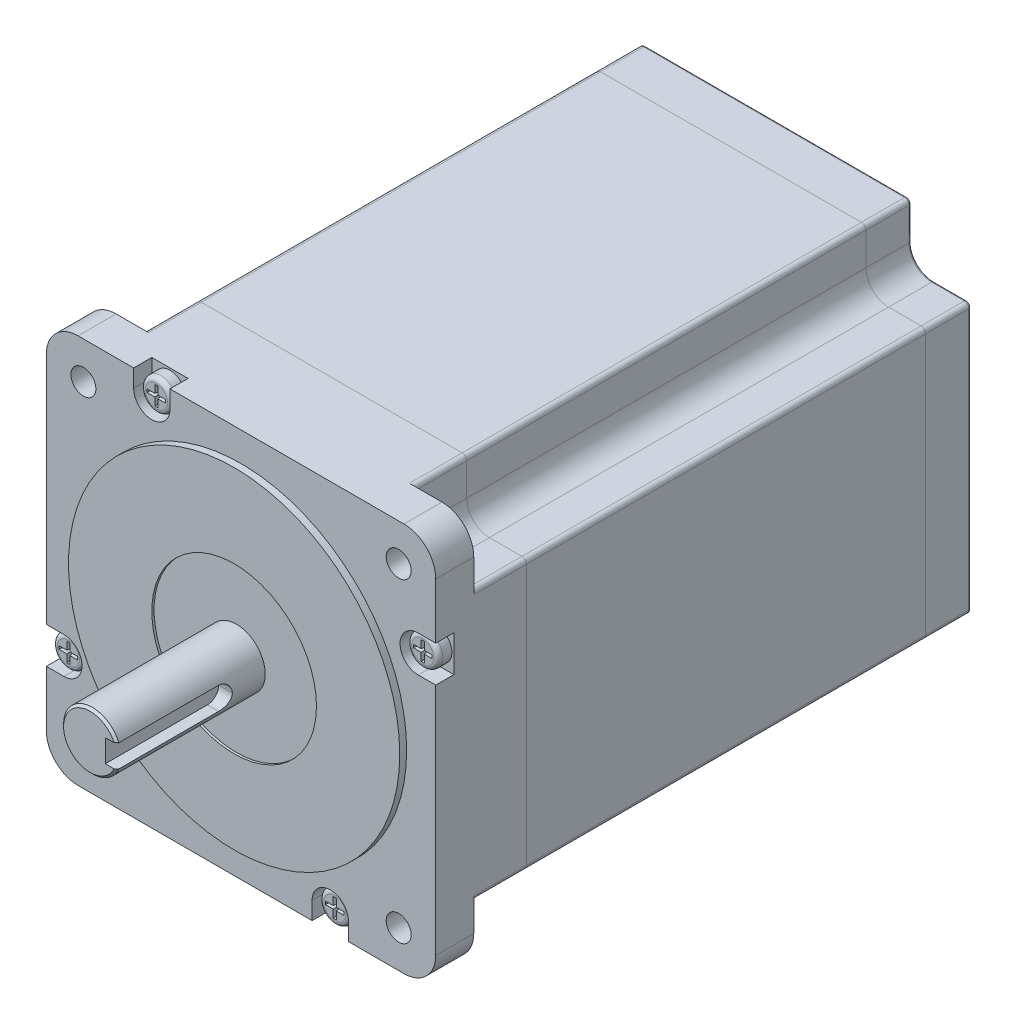
from build123d import *
from OCP.BRepFilletAPI import BRepFilletAPI_MakeChamfer

# Parameters (mm, degrees)
SKETCH1_R                = 2.75
BOSS_EXTRUDE1_DEPTH      = 118
SKETCH2_R                = 36.51
BOSS_EXTRUDE2_DEPTH      = 1.52
BOSS_EXTRUDE3_DEPTH      = 31.75
BOSS_EXTRUDE3_DEPTH_BACK = 1
SKETCH3_R                = 6.35
SKETCH4_W                = 5
SKETCH4_H                = 5
CUT_EXTRUDE1_DEPTH       = 25
FILLET1_R                = 2.5
CHAMFER1_SIZE            = 0.5
SKETCH5_R                = 18.150459798
CUT_EXTRUDE2_DEPTH       = 0.5
CUT_EXTRUDE3_DEPTH       = 109.62
FILLET2_R                = 0.5
FILLET3_R                = 1
SKETCH8_R                = 10
CUT_EXTRUDE4_DEPTH       = 1
SKETCH9_R                = 6
BOSS_EXTRUDE4_DEPTH      = 0.8
CUT_EXTRUDE5_DEPTH       = 4
SKETCH11_R               = 3.434192677
BOSS_EXTRUDE5_DEPTH      = 3
FILLET4_R                = 1
CUT_EXTRUDE6_DEPTH       = 2
CUT_EXTRUDE6_DRAFT       = -6
CHAMFER2_SIZE            = 1.5
CHAMFER2_SIZE2           = 1.685405696
CIRPATTERN3_COUNT        = 4


# Some blends are built 0.0001 mm under size
with BuildPart() as part:
    # Sketch1 → Boss-Extrude1 (new body)
    with BuildSketch(Plane.XY):
        with BuildLine():
            Line((-35.925, -42.925), (35.925, -42.925))
            ThreePointArc((35.925, -42.925), (40.874747468, -40.874747468), (42.925, -35.925))
            Line((42.925, -35.925), (42.925, 35.925))
            ThreePointArc((42.925, 35.925), (40.874747468, 40.874747468), (35.925, 42.925))
            Line((35.925, 42.925), (-35.925, 42.925))
            ThreePointArc((-35.925, 42.925), (-40.874747468, 40.874747468), (-42.925, 35.925))
            Line((-42.925, 35.925), (-42.925, -35.925))
            ThreePointArc((-42.925, -35.925), (-40.874747468, -40.874747468), (-35.925, -42.925))
        make_face()
        with Locations((-34.75, 34.75)):
            Circle(SKETCH1_R, mode=Mode.SUBTRACT)
        with Locations((34.75, 34.75)):
            Circle(SKETCH1_R, mode=Mode.SUBTRACT)
        with Locations((-34.75, -34.75)):
            Circle(SKETCH1_R, mode=Mode.SUBTRACT)
        with Locations((34.75, -34.75)):
            Circle(SKETCH1_R, mode=Mode.SUBTRACT)
    extrude(amount=BOSS_EXTRUDE1_DEPTH)

    # Sketch2 → Boss-Extrude2 (add)
    with BuildSketch(Plane.XY.offset(118)):
        Circle(SKETCH2_R)
    extrude(amount=BOSS_EXTRUDE2_DEPTH)

    # Sketch5 → Cut-Extrude2 (cut)
    with BuildSketch(Plane.XY.offset(119.52)):
        Circle(SKETCH5_R)
    extrude(amount=-CUT_EXTRUDE2_DEPTH, mode=Mode.SUBTRACT)

    # Sketch6 → Cut-Extrude3 (cut)
    with BuildSketch(Plane(origin=(0, 0, 0), x_dir=(-1, 0, 0), z_dir=(0, 0, -1))):
        with BuildLine():
            Line((-29.75, 34.75), (-29.75, 42.925))
            Line((-29.75, 42.925), (-35.925, 42.925))
            ThreePointArc((-35.925, 42.925), (-40.874747468, 40.874747468), (-42.925, 35.925))
            Line((-42.925, 35.925), (-42.925, 29.75))
            Line((-42.925, 29.75), (-34.75, 29.75))
            ThreePointArc((-34.75, 29.75), (-31.214466094, 31.214466094), (-29.75, 34.75))
        make_face()
        with BuildLine():
            Line((35.925, 42.925), (29.75, 42.925))
            Line((29.75, 42.925), (29.75, 34.75))
            ThreePointArc((29.75, 34.75), (31.214466094, 31.214466094), (34.75, 29.75))
            Line((34.75, 29.75), (42.925, 29.75))
            Line((42.925, 29.75), (42.925, 35.925))
            ThreePointArc((42.925, 35.925), (40.874747468, 40.874747468), (35.925, 42.925))
        make_face()
        with BuildLine():
            Line((29.75, -34.75), (29.75, -42.925))
            Line((29.75, -42.925), (35.925, -42.925))
            ThreePointArc((35.925, -42.925), (40.874747468, -40.874747468), (42.925, -35.925))
            Line((42.925, -35.925), (42.925, -29.75))
            Line((42.925, -29.75), (34.75, -29.75))
            ThreePointArc((34.75, -29.75), (31.214466094, -31.214466094), (29.75, -34.75))
        make_face()
        with BuildLine():
            Line((-35.925, -42.925), (-29.75, -42.925))
            Line((-29.75, -42.925), (-29.75, -34.75))
            ThreePointArc((-29.75, -34.75), (-31.214466094, -31.214466094), (-34.75, -29.75))
            Line((-34.75, -29.75), (-42.925, -29.75))
            Line((-42.925, -29.75), (-42.925, -35.925))
            ThreePointArc((-42.925, -35.925), (-40.874747468, -40.874747468), (-35.925, -42.925))
        make_face()
    extrude(amount=-CUT_EXTRUDE3_DEPTH, mode=Mode.SUBTRACT)

    # Fillet2
    fillet2_edges = [part.edges().sort_by_distance(p)[0] for p in [
        (42.925, 0, 0),
        (29.75, -38.8375, 0),
        (31.214466094, -31.214466094, 0),
        (38.8375, -29.75, 0),
        (0, 42.925, 0),
        (31.214466094, 31.214466094, 0),
        (29.75, 38.8375, 0),
        (38.8375, 29.75, 0),
        (-42.925, 0, 0),
        (-29.75, 38.8375, 0),
        (-31.214466094, 31.214466094, 0),
        (-38.8375, 29.75, 0),
        (0, -42.925, 0),
        (-31.214466094, -31.214466094, 0),
        (-29.75, -38.8375, 0),
        (-38.8375, -29.75, 0),
    ]]
    fillet(fillet2_edges, radius=FILLET2_R)

    # Fillet3
    # the kernel refuses this fillet: 1 mm, written as the material it takes off along each edge
    with BuildSketch(Plane(origin=(-41.925, -28.75, 0), x_dir=(0, -1, 0), z_dir=(1, 0, 0))) as fillet3_piece_1:
        with BuildLine():
            CenterArc((0.5, -0.5), 0.5, 0, 90)
            Line((1, -0.5), (1, 0))
            Line((1, 0), (0.5, 0))
        make_face()
    revolve(axis=Axis((-41.925, -28.75, 0), (0, 0, -1)), revolution_arc=90, mode=Mode.SUBTRACT)
    with BuildSketch(Plane(origin=(-41.925, 28.75, 0), x_dir=(-1, 0, 0), z_dir=(0, -1, 0))) as fillet3_piece_2:
        with BuildLine():
            CenterArc((0.5, -0.5), 0.5, 0, 90)
            Line((1, -0.5), (1, 0))
            Line((1, 0), (0.5, 0))
        make_face()
    revolve(axis=Axis((-41.925, 28.75, 0), (0, 0, -1)), revolution_arc=90, mode=Mode.SUBTRACT)
    with BuildSketch(Plane(origin=(-28.75, -41.925, 0), x_dir=(0, -1, 0), z_dir=(1, 0, 0))) as fillet3_piece_3:
        with BuildLine():
            CenterArc((0.5, -0.5), 0.5, 0, 90)
            Line((1, -0.5), (1, 0))
            Line((1, 0), (0.5, 0))
        make_face()
    revolve(axis=Axis((-28.75, -41.925, 0), (0, 0, -1)), revolution_arc=90, mode=Mode.SUBTRACT)
    with BuildSketch(Plane(origin=(28.75, -41.925, 0), x_dir=(1, 0, 0), z_dir=(0, 1, 0))) as fillet3_piece_4:
        with BuildLine():
            CenterArc((0.5, -0.5), 0.5, 0, 90)
            Line((1, -0.5), (1, 0))
            Line((1, 0), (0.5, 0))
        make_face()
    revolve(axis=Axis((28.75, -41.925, 0), (0, 0, -1)), revolution_arc=90, mode=Mode.SUBTRACT)
    with BuildSketch(Plane(origin=(-28.75, 41.925, 0), x_dir=(-1, 0, 0), z_dir=(0, -1, 0))) as fillet3_piece_5:
        with BuildLine():
            CenterArc((0.5, -0.5), 0.5, 0, 90)
            Line((1, -0.5), (1, 0))
            Line((1, 0), (0.5, 0))
        make_face()
    revolve(axis=Axis((-28.75, 41.925, 0), (0, 0, -1)), revolution_arc=90, mode=Mode.SUBTRACT)
    with BuildSketch(Plane(origin=(28.75, 41.925, 0), x_dir=(0, 1, 0), z_dir=(-1, 0, 0))) as fillet3_piece_6:
        with BuildLine():
            CenterArc((0.5, -0.5), 0.5, 0, 90)
            Line((1, -0.5), (1, 0))
            Line((1, 0), (0.5, 0))
        make_face()
    revolve(axis=Axis((28.75, 41.925, 0), (0, 0, -1)), revolution_arc=90, mode=Mode.SUBTRACT)
    with BuildSketch(Plane(origin=(41.925, -28.75, 0), x_dir=(1, 0, 0), z_dir=(0, 1, 0))) as fillet3_piece_7:
        with BuildLine():
            CenterArc((0.5, -0.5), 0.5, 0, 90)
            Line((1, -0.5), (1, 0))
            Line((1, 0), (0.5, 0))
        make_face()
    revolve(axis=Axis((41.925, -28.75, 0), (0, 0, -1)), revolution_arc=90, mode=Mode.SUBTRACT)
    with BuildSketch(Plane(origin=(41.925, 28.75, 0), x_dir=(0, 1, 0), z_dir=(-1, 0, 0))) as fillet3_piece_8:
        with BuildLine():
            CenterArc((0.5, -0.5), 0.5, 0, 90)
            Line((1, -0.5), (1, 0))
            Line((1, 0), (0.5, 0))
        make_face()
    revolve(axis=Axis((41.925, 28.75, 0), (0, 0, -1)), revolution_arc=90, mode=Mode.SUBTRACT)
    with BuildSketch(Plane(origin=(42.925, -29.75, 0), x_dir=(0, 1, 0), z_dir=(0, 0, 1)), Plane(origin=(-42.925, -29.75, 0), x_dir=(1, 0, 0), z_dir=(0, 0, 1)), Plane(origin=(-42.925, 29.75, 0), x_dir=(0, -1, 0), z_dir=(0, 0, 1)), Plane(origin=(29.75, 42.925, 0), x_dir=(-1, 0, 0), z_dir=(0, 0, 1)), Plane(origin=(-29.75, -42.925, 0), x_dir=(1, 0, 0), z_dir=(0, 0, 1))) as fillet3_piece_9:
        with BuildLine():
            CenterArc((FILLET3_R, FILLET3_R), FILLET3_R, 180, 90)
            Line((0, FILLET3_R), (0, 0))
            Line((0, 0), (FILLET3_R, 0))
        make_face()
    extrude(amount=109.62, mode=Mode.SUBTRACT)
    with BuildSketch(Plane(origin=(29.75, -42.925, 0), x_dir=(-1, 0, 0), z_dir=(0, 0, 1)), Plane(origin=(-29.75, 42.925, 0), x_dir=(1, 0, 0), z_dir=(0, 0, 1)), Plane(origin=(42.925, 29.75, 0), x_dir=(0, -1, 0), z_dir=(0, 0, 1))) as fillet3_piece_10:
        with BuildLine():
            CenterArc((FILLET3_R, -FILLET3_R), FILLET3_R, 90, 90)
            Line((0, -FILLET3_R), (0, 0))
            Line((0, 0), (FILLET3_R, 0))
        make_face()
    extrude(amount=109.62, mode=Mode.SUBTRACT)

    # Sketch8 → Cut-Extrude4 (cut)
    with BuildSketch(Plane(origin=(0, 0, 0), x_dir=(-1, 0, 0), z_dir=(0, 0, -1))):
        Circle(SKETCH8_R)
    extrude(amount=-CUT_EXTRUDE4_DEPTH, mode=Mode.SUBTRACT)

    # Sketch10 → Cut-Extrude5 (cut)
    with BuildSketch(Plane.XY.offset(118)):
        with BuildLine():
            Line((-23.668230311, 39.056860772), (-23.668230311, 42.925))
            Line((-23.668230311, 42.925), (-15.668230311, 42.925))
            Line((-15.668230311, 42.925), (-15.668230311, 39.056860772))
            ThreePointArc((-15.668230311, 39.056860772), (-19.668230311, 35.056860772), (-23.668230311, 39.056860772))
        make_face()
        with BuildLine():
            Line((39.056860772, 23.668230311), (42.925, 23.668230311))
            Line((42.925, 23.668230311), (42.925, 15.668230311))
            Line((42.925, 15.668230311), (39.056860772, 15.668230311))
            ThreePointArc((39.056860772, 15.668230311), (35.056860772, 19.668230311), (39.056860772, 23.668230311))
        make_face()
        with BuildLine():
            Line((23.668230311, -39.056860772), (23.668230311, -42.925))
            Line((23.668230311, -42.925), (15.668230311, -42.925))
            Line((15.668230311, -42.925), (15.668230311, -39.056860772))
            ThreePointArc((15.668230311, -39.056860772), (19.668230311, -35.056860772), (23.668230311, -39.056860772))
        make_face()
        with BuildLine():
            Line((-39.056860772, -23.668230311), (-42.925, -23.668230311))
            Line((-42.925, -23.668230311), (-42.925, -15.668230311))
            Line((-42.925, -15.668230311), (-39.056860772, -15.668230311))
            ThreePointArc((-39.056860772, -15.668230311), (-35.056860772, -19.668230311), (-39.056860772, -23.668230311))
        make_face()
    extrude(amount=-CUT_EXTRUDE5_DEPTH, mode=Mode.SUBTRACT)


with BuildPart() as body_2:
    # Sketch3 → Boss-Extrude3 (new, two sides: drawn at the far end of the back side and taken through both)
    with BuildSketch(Plane.XY.offset(119.52).offset(-BOSS_EXTRUDE3_DEPTH_BACK)):
        Circle(SKETCH3_R)
    extrude(amount=BOSS_EXTRUDE3_DEPTH + BOSS_EXTRUDE3_DEPTH_BACK)

    # Sketch4 → Cut-Extrude1 (cut)
    with BuildSketch(Plane.XY.offset(151.27)):
        with Locations((5.85, 0)):
            Rectangle(SKETCH4_W, SKETCH4_H)
    extrude(amount=-CUT_EXTRUDE1_DEPTH, mode=Mode.SUBTRACT)

    # Fillet1
    fillet1_edges = [body_2.edges().sort_by_distance(p)[0] for p in [
        (4.593582704, -2.5, 126.27),
        (4.593582704, 2.5, 126.27),
    ]]
    fillet(fillet1_edges, radius=FILLET1_R - 0.0001)  # a hair under: the kernel refuses the full size

    # Chamfer1
    chamfer1_edges = [body_2.edges().sort_by_distance(p)[0] for p in [
        (-6.35, 0, 151.27),
    ]]
    chamfer(chamfer1_edges, length=CHAMFER1_SIZE)


with BuildPart() as body_3:
    # Sketch9 → Boss-Extrude4 (new body)
    with BuildSketch(Plane(origin=(0, 0, 1), x_dir=(-1, 0, 0), z_dir=(0, 0, -1))):
        Circle(SKETCH9_R)
    extrude(amount=BOSS_EXTRUDE4_DEPTH)


with BuildPart() as body_4:
    # Sketch11 → Boss-Extrude5 (new body)
    with BuildSketch(Plane.XY.offset(114)):
        with Locations((-19.668230311, 39.056860772)):
            Circle(SKETCH11_R)
    extrude(amount=BOSS_EXTRUDE5_DEPTH)

    # Fillet4
    fillet4_edges = [body_4.edges().sort_by_distance(p)[0] for p in [
        (-23.102422989, 39.056860772, 117),
    ]]
    fillet(fillet4_edges, radius=FILLET4_R)


with BuildPart() as cut_extrude6_tool:
    # Sketch12 → Cut-Extrude6 (with draft: the straight prism first)
    with BuildSketch(Plane.XY.offset(117)):
        Polygon((-19.317907501, 39.406818019), (-19.317907501, 41.116130582), (-20.018553122, 41.116130582), (-20.018553122, 39.406818019), (-21.725351266, 39.406818019), (-21.725351266, 38.706903524), (-20.018553122, 38.706903524), (-20.018553122, 36.997590961), (-19.317907501, 36.997590961), (-19.317907501, 38.706903524), (-17.611109357, 38.706903524), (-17.611109357, 39.406818019), align=None)
    extrude(amount=-CUT_EXTRUDE6_DEPTH)
    # Cut-Extrude6: the draft: its side faces are tilted about the plane it starts from
    cut_extrude6_sides = [cut_extrude6_tool.faces().sort_by_distance(p)[0] for p in [
        (-19.317907501, 40.261474301, 116),
        (-19.668230311, 41.116130582, 116),
        (-20.018553122, 40.261474301, 116),
        (-20.871952194, 39.406818019, 116),
        (-21.725351266, 39.056860772, 116),
        (-20.871952194, 38.706903524, 116),
        (-20.018553122, 37.852247243, 116),
        (-19.668230311, 36.997590961, 116),
        (-19.317907501, 37.852247243, 116),
        (-18.464508429, 38.706903524, 116),
        (-17.611109357, 39.056860772, 116),
        (-18.464508429, 39.406818019, 116),
    ]]
    draft(cut_extrude6_sides, Plane.XY.offset(117), CUT_EXTRUDE6_DRAFT)


with BuildPart() as body_4_1:
    add(body_4.part)

    # Cut-Extrude6: cut by cut_extrude6_tool
    add(cut_extrude6_tool.part, mode=Mode.SUBTRACT)

    # Chamfer2: one chamfer whose edges measure the first distance from different faces: ONE call of the kernel's chamfer builder (chamfer() names one face for all edges)
    chamfer2_edges_1 = [body_4_1.edges().sort_by_distance(p)[0] for p in [
        (-17.821317827, 39.056860772, 115),
    ]]
    chamfer2_side_1 = [body_4_1.faces().sort_by_distance(p)[0] for p in [
        (-17.701174773, 39.056860772, 116.143084803),
    ]]
    chamfer2_edges_2 = [body_4_1.edges().sort_by_distance(p)[0] for p in [
        (-19.668230311, 37.207799432, 115),
    ]]
    chamfer2_side_2 = [body_4_1.faces().sort_by_distance(p)[0] for p in [
        (-19.668230311, 37.087678797, 116.142871497),
    ]]
    chamfer2_edges_3 = [body_4_1.edges().sort_by_distance(p)[0] for p in [
        (-21.515142796, 39.056860772, 115),
    ]]
    chamfer2_side_3 = [body_4_1.faces().sort_by_distance(p)[0] for p in [
        (-21.63528585, 39.056860772, 116.143084803),
    ]]
    chamfer2_edges_4 = [body_4_1.edges().sort_by_distance(p)[0] for p in [
        (-19.668230311, 40.905922111, 115),
    ]]
    chamfer2_side_4 = [body_4_1.faces().sort_by_distance(p)[0] for p in [
        (-19.668230311, 41.026042746, 116.142871497),
    ]]
    chamfer2 = BRepFilletAPI_MakeChamfer(body_4_1.part.solid().wrapped)
    for e in chamfer2_edges_1:
        chamfer2.Add(CHAMFER2_SIZE, CHAMFER2_SIZE2, e.wrapped, chamfer2_side_1[0].wrapped)  # the first distance lies on this face
    for e in chamfer2_edges_2:
        chamfer2.Add(CHAMFER2_SIZE, CHAMFER2_SIZE2, e.wrapped, chamfer2_side_2[0].wrapped)  # the first distance lies on this face
    for e in chamfer2_edges_3:
        chamfer2.Add(CHAMFER2_SIZE, CHAMFER2_SIZE2, e.wrapped, chamfer2_side_3[0].wrapped)  # the first distance lies on this face
    for e in chamfer2_edges_4:
        chamfer2.Add(CHAMFER2_SIZE, CHAMFER2_SIZE2, e.wrapped, chamfer2_side_4[0].wrapped)  # the first distance lies on this face
    add(Compound.cast(chamfer2.Shape()), mode=Mode.REPLACE)


with BuildPart() as cirpattern3_1:
    # CirPattern3: pattern copy
    add(body_4_1.part.rotate(Axis((0, 0, 0), (0, 0, 1)), 1 * 360 / CIRPATTERN3_COUNT))


with BuildPart() as cirpattern3_2:
    # CirPattern3: pattern copy
    add(body_4_1.part.rotate(Axis((0, 0, 0), (0, 0, 1)), 2 * 360 / CIRPATTERN3_COUNT))


with BuildPart() as cirpattern3_3:
    # CirPattern3: pattern copy
    add(body_4_1.part.rotate(Axis((0, 0, 0), (0, 0, 1)), 3 * 360 / CIRPATTERN3_COUNT))


solid = Compound([part.part, body_2.part, body_3.part, body_4_1.part, cirpattern3_1.part, cirpattern3_2.part, cirpattern3_3.part])
